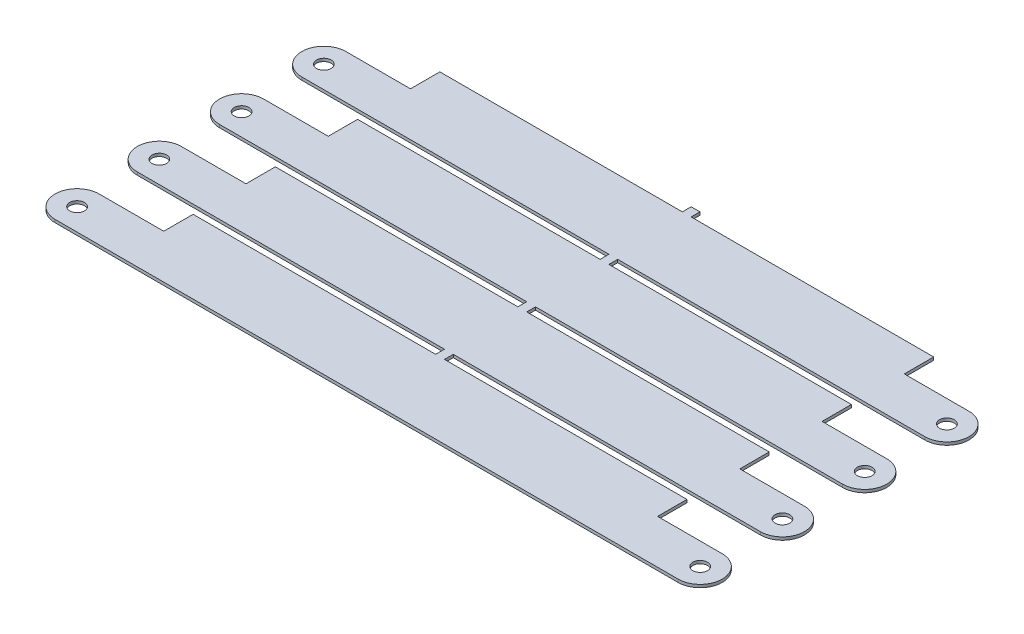
from build123d import *

# Parameters (mm, degrees)
SKETCH1_R           = 2.5
BOSS_EXTRUDE1_DEPTH = 1
LPATTERN1_COUNT     = 4
LPATTERN1_PITCH     = 28


with BuildPart() as part:
    # Sketch1 → Boss-Extrude1 (new body)
    with BuildSketch(Plane(origin=(0, 0, 0), x_dir=(1, 0, 0), z_dir=(0, 1, 0))):
        with BuildLine():
            Line((22, 7.5), (0, 7.5))
            ThreePointArc((0, 7.5), (-7.5, 0), (0, -7.5))
            Line((0, -7.5), (212.13, -7.5))
            ThreePointArc((212.13, -7.5), (219.63, 0), (212.13, 7.5))
            Line((212.13, 7.5), (190.13, 7.5))
            Line((190.13, 7.5), (190.13, 17.5))
            Line((190.13, 17.5), (107.565, 17.5))
            Line((107.565, 17.5), (107.565, 20.5))
            Line((107.565, 20.5), (104.565, 20.5))
            Line((104.565, 20.5), (104.565, 17.5))
            Line((104.565, 17.5), (22, 17.5))
            Line((22, 17.5), (22, 7.5))
        make_face()
        Circle(SKETCH1_R, mode=Mode.SUBTRACT)
        with Locations((212.13, 0)):
            Circle(SKETCH1_R, mode=Mode.SUBTRACT)
    boss_extrude1 = extrude(amount=BOSS_EXTRUDE1_DEPTH)

    # LPattern1: Boss-Extrude1 ×4
    with Locations(*[(0, 0, -i * LPATTERN1_PITCH) for i in range(1, LPATTERN1_COUNT)]):
        add(boss_extrude1)


solid = part.part
